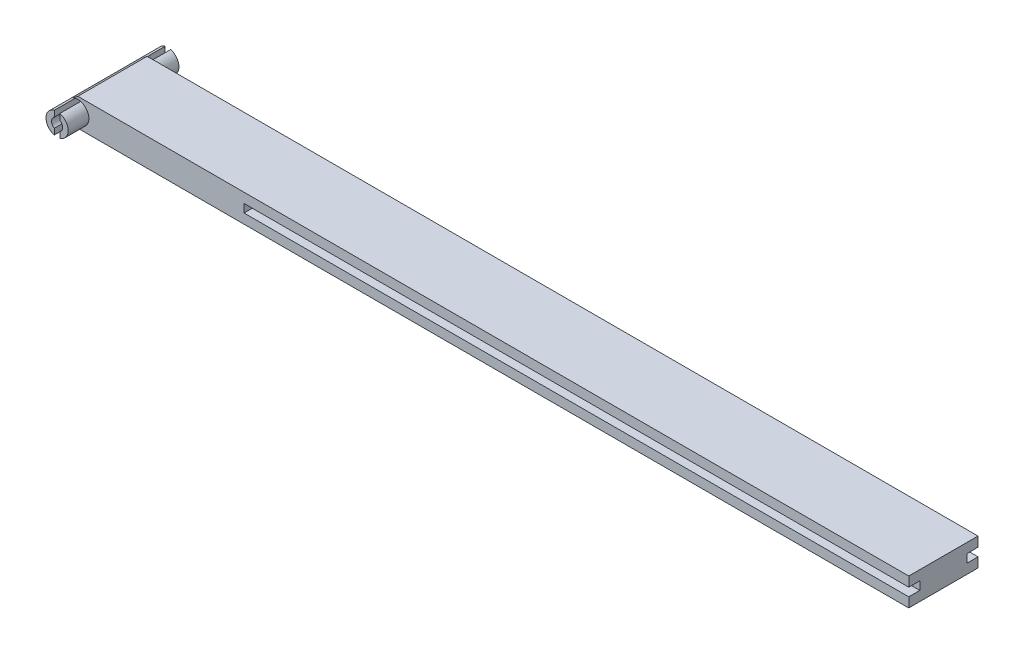
from build123d import *

# Parameters (mm, degrees)
SKETCH2_W                = 150
SKETCH2_H                = 12.5
BOSS_EXTRUDE1_DEPTH      = 5
BOSS_EXTRUDE2_DEPTH      = 10
BOSS_EXTRUDE2_DEPTH_BACK = 10
SKETCH3_R                = 2
FILLET1_R                = 10
SKETCH4_R                = 1
CUT_EXTRUDE1_DEPTH       = 80.711981534
CUT_EXTRUDE2_START       = -20
SKETCH5_W                = 1
SKETCH5_H                = 4
CUT_EXTRUDE2_DEPTH       = 20
SKETCH6_W                = 120
SKETCH6_H                = 1.5
CUT_EXTRUDE3_DEPTH       = 2


with BuildPart() as part:
    # Sketch2 → Boss-Extrude1 (new body)
    with BuildSketch(Plane(origin=(0, 0, 0), x_dir=(1, 0, 0), z_dir=(0, 1, 0))):
        Rectangle(SKETCH2_W, SKETCH2_H)
    extrude(amount=BOSS_EXTRUDE1_DEPTH)

    # Sketch3 → Boss-Extrude2 (add, two sides: drawn at the far end of the back side and taken through both)
    with BuildSketch(Plane.XY.offset(-BOSS_EXTRUDE2_DEPTH_BACK)):
        with Locations((-75, 2.5)):
            Circle(SKETCH3_R)
    extrude(amount=BOSS_EXTRUDE2_DEPTH + BOSS_EXTRUDE2_DEPTH_BACK)

    # Fillet1
    # the kernel refuses this fillet: 10 mm, written as the material it adds along each edge
    with BuildSketch(Plane(origin=(-75, 4.5, 6.25), x_dir=(-5.0590642785823295e-12, 1.0, 0), z_dir=(0, 0, -1))) as fillet1_piece_1:
        with BuildLine():
            CenterArc((8.05, -6.557247898), FILLET1_R, 139.025369771, 7.851690022)
            Line((-0.325, -1.09287465), (-0.4925, -0.983587185))
            ThreePointArc((-0.4925, -0.983587185), (-0.274673944, -0.513078941), (-0.2, 0))
            Line((-0.2, 0), (0, 0.2))
            ThreePointArc((0, 0.2), (0.25, 0.2), (0.349, 0.131144958))
            Line((0.349, 0.131144958), (0.5, 0))
        make_face()
    extrude(amount=6.25)
    with BuildSketch(Plane(origin=(-75, 0.5, 6.25), x_dir=(-5.059064278582354e-12, -1.0, 0), z_dir=(0, 0, -1)), Plane(origin=(-75, 4.5, -6.25), x_dir=(-5.0590642785823295e-12, 1.0, 0), z_dir=(0, 0, 1))) as fillet1_piece_2:
        with BuildLine():
            CenterArc((8.05, 6.557247898), FILLET1_R, 213.122940208, 7.851690022)
            Line((-0.325, 1.09287465), (-0.4925, 0.983587185))
            ThreePointArc((-0.4925, 0.983587185), (-0.274673944, 0.513078941), (-0.2, 0))
            Line((-0.2, 0), (0, -0.2))
            ThreePointArc((0, -0.2), (0.25, -0.2), (0.349, -0.131144958))
            Line((0.349, -0.131144958), (0.5, 0))
        make_face()
    extrude(amount=6.25)
    with BuildSketch(Plane(origin=(-75, 0.5, -6.25), x_dir=(-0.9585144756337048, 0.2850438562759136, 0), z_dir=(0, 0, 1))) as fillet1_piece_3:
        with BuildLine():
            CenterArc((3.990613988, 9.585144756), FILLET1_R, 245.586839874, 7.851690022)
            Line((-0.142521928, 0.479257238), (-0.225184646, 0.297139487))
            ThreePointArc((-0.225184646, 0.297139487), (-0.262963859, 0.182619848), (-0.191702895, -0.057008771))
            Line((-0.191702895, -0.057008771), (0.057008771, -0.191702895))
            ThreePointArc((0.057008771, -0.191702895), (0.570087713, -0.117028951), (1.083166654, -0.191702895))
            Line((1.083166654, -0.191702895), (1.140175425, 0))
        make_face()
    extrude(amount=6.25)

    # Sketch4 → Cut-Extrude1 (cut, through all)
    with BuildSketch(Plane.XY.offset(10)):
        with Locations((-75, 2.5)):
            Circle(SKETCH4_R)
    extrude(amount=-CUT_EXTRUDE1_DEPTH, mode=Mode.SUBTRACT)

    # Sketch5 → Cut-Extrude2 (cut)
    with BuildSketch(Plane.XY.offset(10).offset(CUT_EXTRUDE2_START)):
        with Locations((-75, 2.5)):
            Rectangle(SKETCH5_W, SKETCH5_H)
    cut_extrude2 = extrude(amount=CUT_EXTRUDE2_DEPTH, mode=Mode.SUBTRACT)

    # Mirror3: Cut-Extrude2 across plane
    add(cut_extrude2.mirror(Plane.XY), mode=Mode.SUBTRACT)

    # Sketch6 → Cut-Extrude3 (cut)
    with BuildSketch(Plane.XY.offset(6.25)):
        with Locations((15, 2.5)):
            Rectangle(SKETCH6_W, SKETCH6_H)
    cut_extrude3 = extrude(amount=-CUT_EXTRUDE3_DEPTH, mode=Mode.SUBTRACT)

    # Mirror4: Cut-Extrude3 across plane
    add(cut_extrude3.mirror(Plane.XY), mode=Mode.SUBTRACT)


solid = part.part
